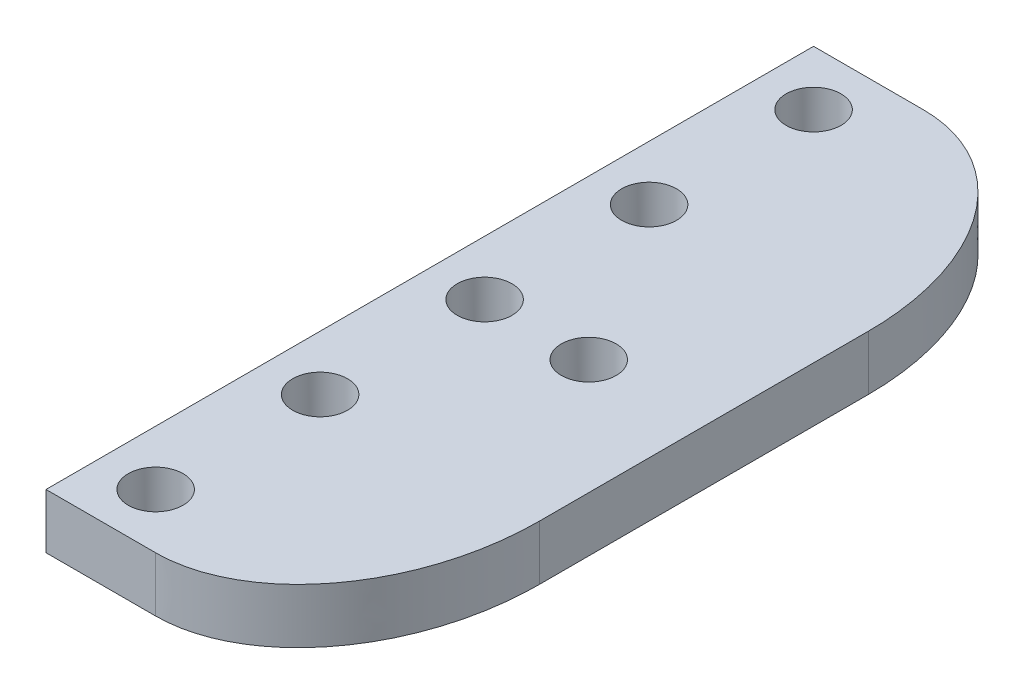
from build123d import *

# Parameters (mm, degrees)
BOSS_EXTRUDE1_DEPTH     = 70
CUT_EXTRUDE2_DEPTH      = 72.282887147
CUT_EXTRUDE2_DEPTH_BACK = 72.282887147
SKETCH2_R               = 2.5
FILLET1_SIZE            = 20
FILLET1_SIZE_2          = 15


with BuildPart() as part:
    # Sketch1 → Boss-Extrude1 (new body)
    with BuildSketch(Plane.XY):
        Polygon((6.5, 2.5), (12.5, 2.5), (12.5, -2.5), (-12.5, -2.5), (-12.5, 2.5), align=None)
    extrude(amount=BOSS_EXTRUDE1_DEPTH)

    # Sketch2 → Cut-Extrude2 (cut, two sides: drawn at the far end of the back side and taken through both)
    with BuildSketch(Plane(origin=(0, 2.5, 0), x_dir=(1, 0, 0), z_dir=(0, 1, 0)).offset(-CUT_EXTRUDE2_DEPTH_BACK)):
        with Locations(Location((-7.5, -5, 0), (0, 0, 270))):
            Circle(SKETCH2_R)
        with Locations(Location((-7.5, -20, 0), (0, 0, 270))):
            Circle(SKETCH2_R)
        with Locations(Location((-7.5, -35, 0), (0, 0, 270))):
            Circle(SKETCH2_R)
        with Locations(Location((-7.5, -50, 0), (0, 0, 270))):
            Circle(SKETCH2_R)
        with Locations(Location((-7.5, -65, 0), (0, 0, 270))):
            Circle(SKETCH2_R)
        with Locations(Location((2, -35, 0), (0, 0, 270))):
            Circle(SKETCH2_R)
    extrude(amount=CUT_EXTRUDE2_DEPTH + CUT_EXTRUDE2_DEPTH_BACK, mode=Mode.SUBTRACT)

    # Fillet1
    # an asymmetric fillet: 20, 15 mm, written as the material it takes off along each edge
    with BuildSketch(Plane(origin=(12.5, 52.5, 70), x_dir=(0, 0, -1), z_dir=(0, -1, 0))) as fillet1_piece_1:
        with BuildLine():
            Bezier((FILLET1_SIZE, 0), (0, 0), (0, -FILLET1_SIZE_2), weights=[1, 0.707106781, 1])
            Line((0, -FILLET1_SIZE_2), (0, 0))
            Line((0, 0), (FILLET1_SIZE, 0))
        make_face()
    extrude(amount=105, mode=Mode.SUBTRACT)
    with BuildSketch(Plane(origin=(12.5, 52.5, 0), x_dir=(0, 0, 1), z_dir=(0, -1, 0))) as fillet1_piece_2:
        with BuildLine():
            Bezier((FILLET1_SIZE, 0), (0, 0), (0, FILLET1_SIZE_2), weights=[1, 0.707106781, 1])
            Line((0, FILLET1_SIZE_2), (0, 0))
            Line((0, 0), (FILLET1_SIZE, 0))
        make_face()
    extrude(amount=105, mode=Mode.SUBTRACT)


solid = part.part
